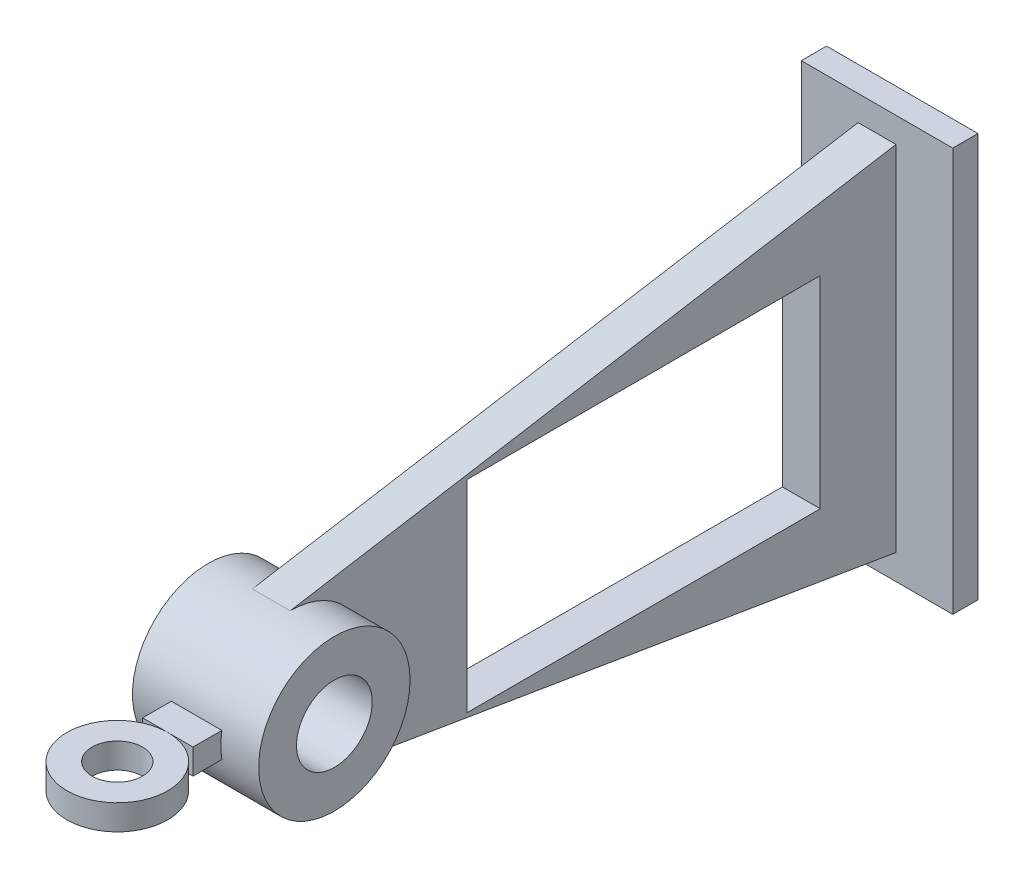
from build123d import *

# Parameters (mm, degrees)
BASE_PLATE_SKETCH_W             = 101.6
BASE_PLATE_SKETCH_H             = 38.1
BASE_PLATE_DEPTH                = 6.35
A_FRAME_BODY_DEPTH              = 4.7625
A_FRAME_BODY_DEPTH_BACK         = 4.7625
CENTER_CUTOUT_DEPTH             = 162.769287876
CENTER_CUTOUT_DEPTH_BACK        = 162.769287876
CENTER_CUTOUT_SKETCH_W          = 50.8
CENTER_CUTOUT_SKETCH_H          = 88.9
BEARING_HOUSING_DEPTH           = 15.875
BEARING_HOUSING_DEPTH_BACK      = 15.875
BEARING_HOUSING_SKETCH_R        = 19.05
BEARING_THROUGH_HOLE_DEPTH      = 180.829488683
BEARING_THROUGH_HOLE_DEPTH_BACK = 180.829488683
BEARING_HOLE_SKETCH_R           = 9.525
EYELET_CONNECTOR_DEPTH          = 3.175
EYELET_CONNECTOR_DEPTH_BACK     = 3.175
EYELET_CONNECTOR_SKETCH_W       = 12.7
EYELET_CONNECTOR_SKETCH_H       = 12.7
LIFTING_EYELET_DEPTH            = 3.175
LIFTING_EYELET_DEPTH_BACK       = 3.175
EYELET_RING_SKETCH_R            = 12.7
EYELET_RING_SKETCH_R_2          = 6.35


with BuildPart() as part:
    # Base Plate Sketch → Base Plate (new body)
    with BuildSketch(Plane(origin=(0, 0, 0), x_dir=(0, 1, 0), z_dir=(0, 0, 1))):
        Rectangle(BASE_PLATE_SKETCH_W, BASE_PLATE_SKETCH_H)
    extrude(amount=-BASE_PLATE_DEPTH)

    # A-Frame Sketch → A-Frame Body (add, two sides: drawn at the far end of the back side and taken through both)
    with BuildSketch(Plane.YZ.offset(-A_FRAME_BODY_DEPTH_BACK)):
        Polygon((-44.45, 0), (44.45, 0), (19.05, 152.4), (-19.05, 152.4), align=None)
    extrude(amount=A_FRAME_BODY_DEPTH + A_FRAME_BODY_DEPTH_BACK)

    # Center Cutout Sketch → Center Cutout (cut, two sides: drawn at the far end of the back side and taken through both)
    with BuildSketch(Plane.YZ.offset(-CENTER_CUTOUT_DEPTH_BACK)):
        with Locations((0, 63.5)):
            Rectangle(CENTER_CUTOUT_SKETCH_W, CENTER_CUTOUT_SKETCH_H)
    extrude(amount=CENTER_CUTOUT_DEPTH + CENTER_CUTOUT_DEPTH_BACK, mode=Mode.SUBTRACT)

    # Bearing Housing Sketch → Bearing Housing (add, two sides: drawn at the far end of the back side and taken through both)
    with BuildSketch(Plane.YZ.offset(-BEARING_HOUSING_DEPTH_BACK)):
        with Locations((0, 152.4)):
            Circle(BEARING_HOUSING_SKETCH_R)
    extrude(amount=BEARING_HOUSING_DEPTH + BEARING_HOUSING_DEPTH_BACK)

    # Bearing Hole Sketch → Bearing Through-Hole (cut, two sides: drawn at the far end of the back side and taken through both)
    with BuildSketch(Plane.YZ.offset(-BEARING_THROUGH_HOLE_DEPTH_BACK)):
        with Locations((0, 152.4)):
            Circle(BEARING_HOLE_SKETCH_R)
    extrude(amount=BEARING_THROUGH_HOLE_DEPTH + BEARING_THROUGH_HOLE_DEPTH_BACK, mode=Mode.SUBTRACT)

    # Eyelet Connector Sketch → Eyelet Connector (add, two sides: drawn at the far end of the back side and taken through both)
    with BuildSketch(Plane(origin=(0, 0, 0), x_dir=(-1, 0, 0), z_dir=(0, 1, 0)).offset(-EYELET_CONNECTOR_DEPTH_BACK)):
        with Locations((0, 172.085)):
            Rectangle(EYELET_CONNECTOR_SKETCH_W, EYELET_CONNECTOR_SKETCH_H)
    extrude(amount=EYELET_CONNECTOR_DEPTH + EYELET_CONNECTOR_DEPTH_BACK)


with BuildPart() as body_2:
    # Eyelet Ring Sketch → Lifting Eyelet (new, two sides: drawn at the far end of the back side and taken through both)
    with BuildSketch(Plane(origin=(0, 0, 0), x_dir=(-1, 0, 0), z_dir=(0, 1, 0)).offset(-LIFTING_EYELET_DEPTH_BACK)):
        with Locations((0, 191.135)):
            Circle(EYELET_RING_SKETCH_R)
        with Locations((0, 191.135)):
            Circle(EYELET_RING_SKETCH_R_2, mode=Mode.SUBTRACT)
    extrude(amount=LIFTING_EYELET_DEPTH + LIFTING_EYELET_DEPTH_BACK)


solid = Compound([part.part, body_2.part])
